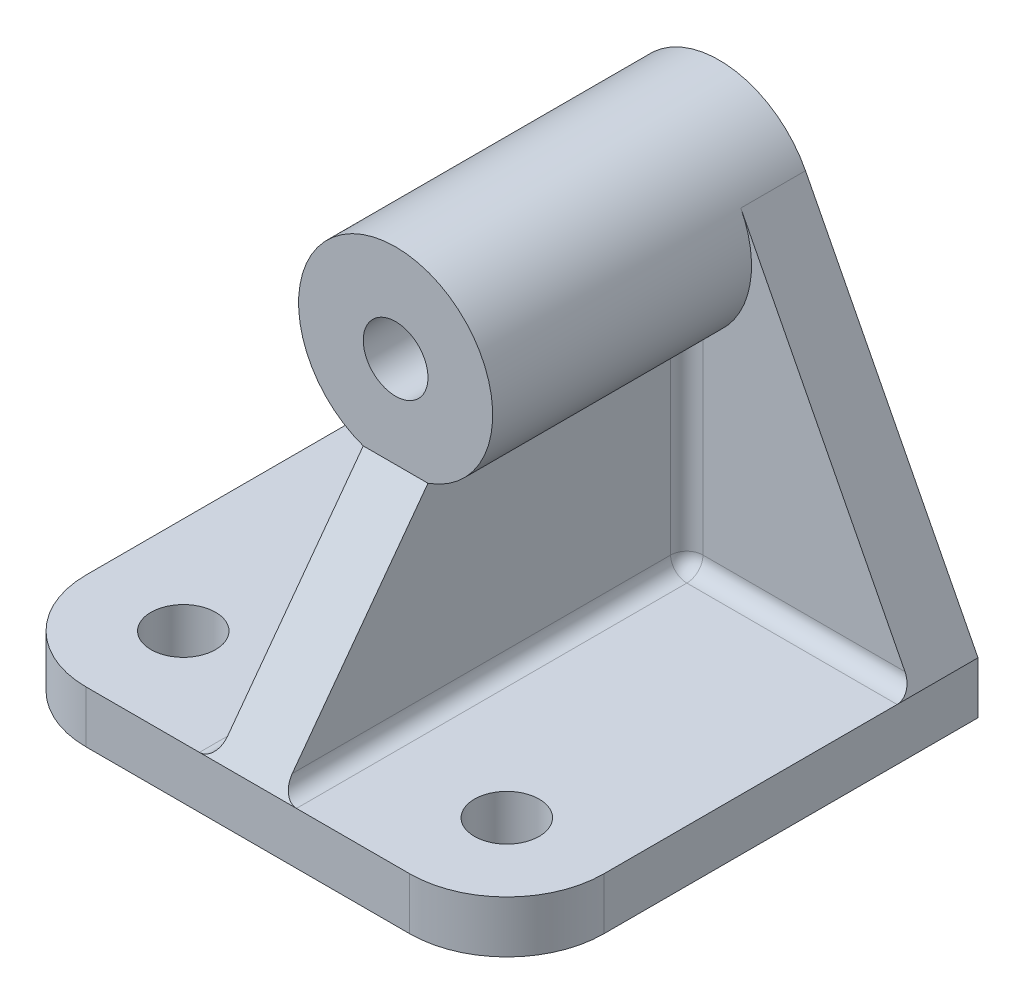
from build123d import *

# Parameters (mm, degrees)
SKETCH2_W            = 145.63575991
SKETCH2_H            = 16.06113598
BOSS_EXTRUDE1_DEPTH  = 80
SKETCH3_R            = 10
CUT_EXTRUDE1_DEPTH   = 110.363630747
BOSS_EXTRUDE2_DEPTH  = 20
SKETCH5_R            = 30
SKETCH5_R_2          = 10
BOSS_EXTRUDE3_DEPTH  = 100
FILLET1_R            = 5
BOSS_EXTRUDE9_REACH  = 183.085
BOSS_EXTRUDE10_DEPTH = 10
FILLET2_R            = 5
FILLET3_R            = 30


with BuildPart() as part:
    # Sketch2 → Boss-Extrude1 (new, symmetric)
    with BuildSketch(Plane(origin=(0, 0, 0), x_dir=(0, 0, -1), z_dir=(1, 0, 0))):
        Rectangle(SKETCH2_W, SKETCH2_H)
    extrude(amount=BOSS_EXTRUDE1_DEPTH, both=True)

    # Sketch3 → Cut-Extrude1 (cut, through all)
    with BuildSketch(Plane(origin=(0, 8.03056799, 0), x_dir=(1, 0, 0), z_dir=(0, 1, 0))):
        with Locations(Location((50, -42.817879955, 0), (0, 0, 270))):
            Circle(SKETCH3_R)
        with Locations(Location((-50, -42.817879955, 0), (0, 0, 270))):
            Circle(SKETCH3_R)
    extrude(amount=-CUT_EXTRUDE1_DEPTH, mode=Mode.SUBTRACT)

    # Sketch4 → Boss-Extrude2 (add)
    with BuildSketch(Plane(origin=(0, 0, -72.817879955), x_dir=(-1, 0, 0), z_dir=(0, 0, -1))):
        with BuildLine():
            Line((-26.680786367, 111.746822538), (-80, 8.03056799))
            Line((-80, 8.03056799), (80, 8.03056799))
            Line((80, 8.03056799), (26.680786367, 111.746822538))
            ThreePointArc((26.680786367, 111.746822538), (29.158391511, 105.086643705), (30, 98.03056799))
            ThreePointArc((30, 98.03056799), (-7.056075715, 68.872176479), (-26.680786367, 111.746822538))
        make_face()
    extrude(amount=-BOSS_EXTRUDE2_DEPTH)

    # Sketch5 → Boss-Extrude3 (add)
    with BuildSketch(Plane(origin=(0, 0, -72.817879955), x_dir=(-1, 0, 0), z_dir=(0, 0, -1))):
        with Locations((0, 98.03056799)):
            Circle(SKETCH5_R)
        with Locations((0, 98.03056799)):
            Circle(SKETCH5_R_2, mode=Mode.SUBTRACT)
    extrude(amount=-BOSS_EXTRUDE3_DEPTH)

    # Fillet1
    fillet1_edges = [part.edges().sort_by_distance(p)[0] for p in [
        (0, 8.03056799, -52.817879955),
    ]]
    fillet(fillet1_edges, radius=FILLET1_R)

    # Boss-Extrude9: up to this face of the body (flat: up to its plane)
    boss_extrude9_end = Plane(part.part.faces().sort_by_distance((0, 43.997298741, -52.817879955))[0])
    # Sketch12 → Boss-Extrude9 (add, up to the picked face)
    with BuildSketch(Plane.XY.offset(27.182120045), mode=Mode.PRIVATE) as boss_extrude9_sk1:
        with BuildLine():
            Line((10, 69.746296743), (10, 8.03056799))
            Line((10, 8.03056799), (-10, 8.03056799))
            Line((-10, 8.03056799), (-10, 69.746296743))
            ThreePointArc((-10, 69.746296743), (0, 68.03056799), (10, 69.746296743))
        make_face()
    boss_extrude9_tool1 = split(extrude(boss_extrude9_sk1.sketch, amount=-BOSS_EXTRUDE9_REACH, mode=Mode.PRIVATE), bisect_by=boss_extrude9_end, keep=Keep.BOTH, mode=Mode.PRIVATE)
    add(boss_extrude9_tool1.solids().sort_by(Axis((0, 38.315311, 27.18212), (0, 0, -1)))[0])

    # Sketch14 → Boss-Extrude10 (add, symmetric)
    with BuildSketch(Plane(origin=(0, 0, 0), x_dir=(0, 0, -1), z_dir=(1, 0, 0))):
        Polygon((-27.182120045, 69.746296743), (-72.817879955, 8.03056799), (-27.182120045, 8.03056799), align=None)
    extrude(amount=BOSS_EXTRUDE10_DEPTH, both=True)

    # Fillet2
    # the kernel refuses this fillet: 5 mm, written as the material it adds along each edge
    with BuildSketch(Plane(origin=(10, 13.03056799, -47.817879955), x_dir=(0, 0, -1), z_dir=(0, 1, 0))) as fillet2_piece_1:
        with BuildLine():
            CenterArc((5 - FILLET2_R, -FILLET2_R), FILLET2_R, 0, 90)
            Line((5, -FILLET2_R), (5, 0))
            Line((5, 0), (5 - FILLET2_R, 0))
        make_face()
    revolve(axis=Axis((10, 13.03056799, -47.817879955), (-1, 0, 0)), revolution_arc=90)
    with BuildSketch(Plane(origin=(-10, 13.03056799, -47.817879955), x_dir=(0, 0, -1), z_dir=(0, 1, 0))) as fillet2_piece_2:
        with BuildLine():
            CenterArc((5 - FILLET2_R, FILLET2_R), FILLET2_R, 270, 90)
            Line((5, FILLET2_R), (5, 0))
            Line((5, 0), (5 - FILLET2_R, 0))
        make_face()
    revolve(axis=Axis((-10, 13.03056799, -47.817879955), (-1, 0, 0)), revolution_arc=90)
    with BuildSketch(Plane(origin=(-10, 8.03056799, 72.817879955), x_dir=(-1, 0, 0), z_dir=(0, 0, -1))) as fillet2_piece_3_section:
        with BuildLine():
            CenterArc((FILLET2_R, FILLET2_R), FILLET2_R, 180, 90)
            Line((0, FILLET2_R), (0, 0))
            Line((0, 0), (FILLET2_R, 0))
        make_face()
    fillet2_piece_3 = extrude(amount=120.63575991, mode=Mode.PRIVATE)
    fillet2_piece_3 = split(fillet2_piece_3, bisect_by=Plane(origin=(-10, 8.03056799, 72.817879955), z_dir=(0, -0.5945577575874679, -0.8040529042871258)), keep=Keep.TOP, mode=Mode.PRIVATE)
    add(fillet2_piece_3)
    with BuildSketch(Plane(origin=(-10, 82.246296743, -52.817879955), x_dir=(0, 0, 1), z_dir=(0, -1, 0))) as fillet2_piece_4:
        with BuildLine():
            CenterArc((FILLET2_R, FILLET2_R), FILLET2_R, 180, 90)
            Line((0, FILLET2_R), (0, 0))
            Line((0, 0), (FILLET2_R, 0))
        make_face()
    extrude(amount=69.215728753)
    with BuildSketch(Plane(origin=(10, 13.03056799, -52.817879955), x_dir=(1, 0, 0), z_dir=(0, 1, 0))) as fillet2_piece_5:
        with BuildLine():
            CenterArc((FILLET2_R, -FILLET2_R), FILLET2_R, 90, 90)
            Line((0, -FILLET2_R), (0, 0))
            Line((0, 0), (FILLET2_R, 0))
        make_face()
    extrude(amount=69.215728753)
    with BuildSketch(Plane(origin=(10, 8.03056799, -47.817879955), x_dir=(1, 0, 0), z_dir=(0, 0, 1))) as fillet2_piece_6_section:
        with BuildLine():
            CenterArc((FILLET2_R, FILLET2_R), FILLET2_R, 180, 90)
            Line((0, FILLET2_R), (0, 0))
            Line((0, 0), (FILLET2_R, 0))
        make_face()
    fillet2_piece_6 = extrude(amount=120.63575991, mode=Mode.PRIVATE)
    fillet2_piece_6 = split(fillet2_piece_6, bisect_by=Plane(origin=(10, 65.701203771, 30.173268256), z_dir=(0, -0.5945577575874679, -0.8040529042871258)), keep=Keep.TOP, mode=Mode.PRIVATE)
    add(fillet2_piece_6)

    # Fillet3
    fillet3_edges = [part.edges().sort_by_distance(p)[0] for p in [
        (80, 0, 72.817879955),
        (-80, 0, 72.817879955),
    ]]
    fillet(fillet3_edges, radius=FILLET3_R)


solid = part.part
